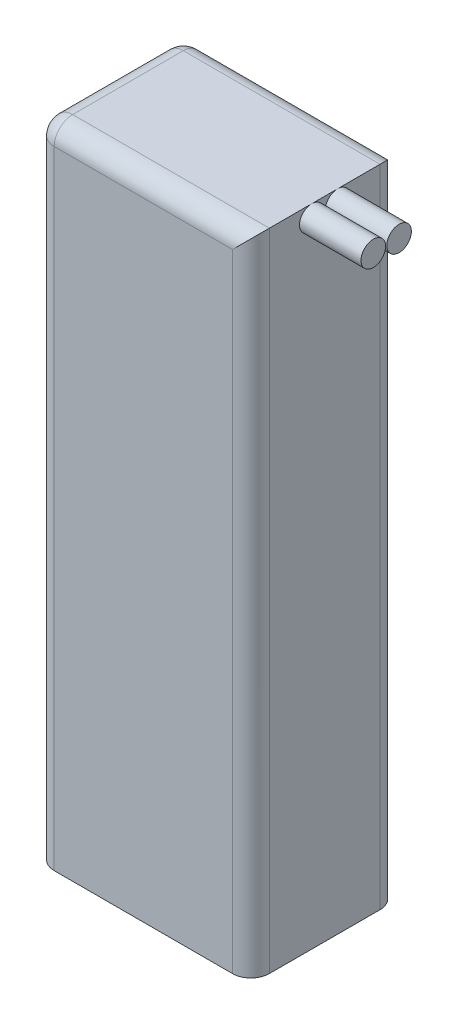
from build123d import *

# Parameters (mm, degrees)
SKETCH2_W           = 35
SKETCH2_H           = 24
BOSS_EXTRUDE1_DEPTH = 105
SKETCH5_R           = 2
BOSS_EXTRUDE2_DEPTH = 10
FILLET1_R           = 3


with BuildPart() as part:
    # Sketch2 → Boss-Extrude1 (new body)
    with BuildSketch(Plane(origin=(0, 0, 0), x_dir=(1, 0, 0), z_dir=(0, 1, 0))):
        with Locations((17.5, 12)):
            Rectangle(SKETCH2_W, SKETCH2_H)
    extrude(amount=BOSS_EXTRUDE1_DEPTH)

    # Sketch5 → Boss-Extrude2 (add)
    with BuildSketch(Plane(origin=(35, 0, 0), x_dir=(0, 0, -1), z_dir=(1, 0, 0))):
        with Locations((9.9, 103)):
            Circle(SKETCH5_R)
        with Locations((14.1, 103)):
            Circle(SKETCH5_R)
    extrude(amount=BOSS_EXTRUDE2_DEPTH)

    # Fillet1
    fillet1_edges = [part.edges().sort_by_distance(p)[0] for p in [
        (0, 105, -12),
        (17.5, 105, -24),
        (0, 52.5, -24),
        (35, 52.5, -24),
        (0, 52.5, 0),
        (35, 52.5, 0),
        (17.5, 105, 0),
    ]]
    fillet(fillet1_edges, radius=FILLET1_R)


solid = part.part
